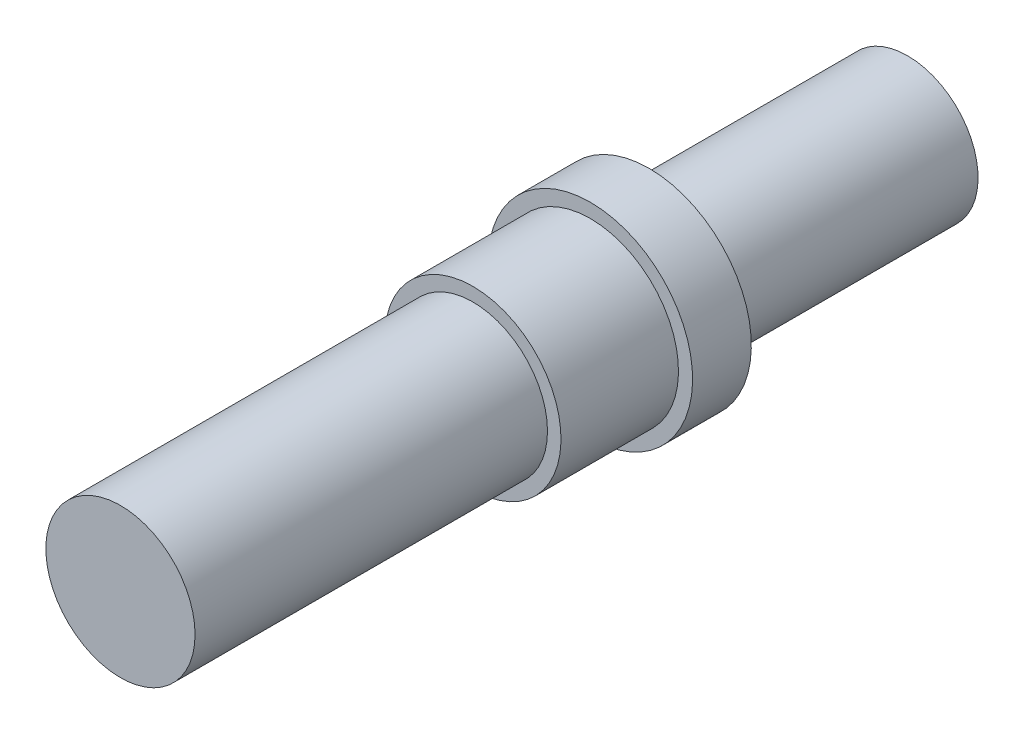
from build123d import *

# Parameters (mm, degrees)
SKETCH5_R             = 6.35
OUTSIDE_EXTRUDE_DEPTH = 30
INSIDE_START          = 2
SKETCH6_R             = 6
INSIDE_EXTRUDE_DEPTH  = 2


with BuildPart() as part:
    # Sketch3 → Initial Resolve -- Exact Length (revolve)
    with BuildSketch(Plane(origin=(0, 0, 0), x_dir=(0, 0, -1), z_dir=(1, 0, 0))):
        Polygon((9.998219577, 8.7), (14.998219577, 8.7), (14.998219577, 6), (34.998219577, 6), (34.998219577, 0), (0, 0), (-0.001780423, 0), (-0.001780423, 7.5), (9.998219577, 7.5), align=None)
    revolve(axis=Axis((0, 0, -34.998219577), (0, 0, 1)))

    # Sketch5 → Outside Extrude (add)
    with BuildSketch(Plane.XY.offset(0.001780423)):
        Circle(SKETCH5_R)
    extrude(amount=OUTSIDE_EXTRUDE_DEPTH)

    # Sketch6 → Inside Extrude (add)
    with BuildSketch(Plane(origin=(0, 0, -34.998219577), x_dir=(-1, 0, 0), z_dir=(0, 0, -1)).offset(INSIDE_START)):
        Circle(SKETCH6_R)
    extrude(amount=-INSIDE_EXTRUDE_DEPTH)


solid = part.part
